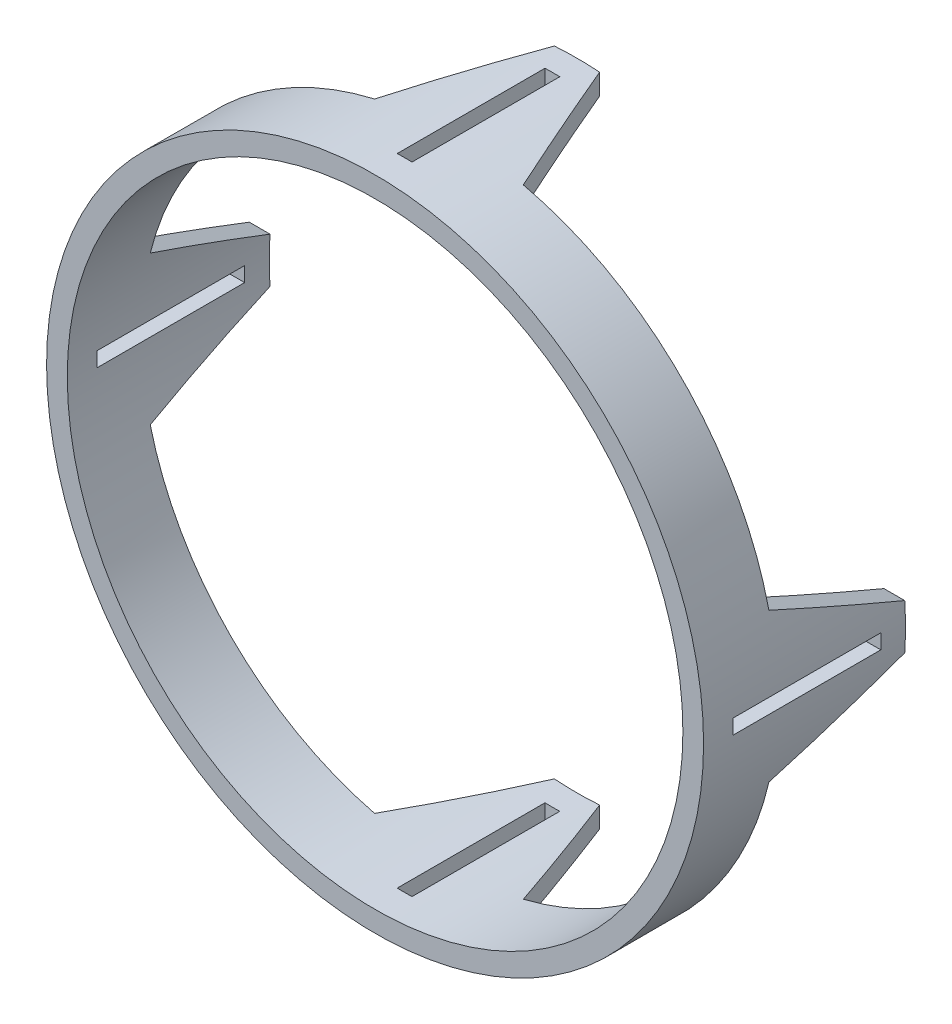
from build123d import *
from build123d.topology import SkipClean

# Parameters (mm, degrees)
SKETCH1_R           = 84.709
SKETCH1_R_2         = 79.375
BOSS_EXTRUDE1_DEPTH = 19.05
BOSS_EXTRUDE2_START = 33.02
BOSS_EXTRUDE2_DEPTH = 33.02
SKETCH2_W           = 3.81
SKETCH2_H           = 38.1
CUT_EXTRUDE1_DEPTH  = 125.264032455
CIRPATTERN1_COUNT   = 4
CHAMFER1_SIZE       = 13.462
CHAMFER1_SIZE_2     = 33.319619221


with BuildPart() as part:
    # Sketch1 → Boss-Extrude1 (new body)
    with BuildSketch(Plane.XY):
        with Locations(Location((0, 0, 0), (0, 0, 180))):
            Circle(SKETCH1_R)
        with Locations(Location((0, 0, 0), (0, 0, 180))):
            Circle(SKETCH1_R_2, mode=Mode.SUBTRACT)
    extrude(amount=BOSS_EXTRUDE1_DEPTH)

    # Sketch3 → Boss-Extrude2 (add)
    with SkipClean():  # the faces are left unmerged after this step: merging them gives an invalid solid
        with BuildSketch(Plane(origin=(0, 0, 0), x_dir=(-1, 0, 0), z_dir=(0, 0, -1)).offset(BOSS_EXTRUDE2_START)):
            with BuildLine():
                Line((-5.715, 79.168992668), (-5.715, 84.515995267))
                ThreePointArc((-5.715, 84.515995267), (0, 84.709), (5.715, 84.515995267))
                Line((5.715, 84.515995267), (5.715, 79.168992668))
                ThreePointArc((5.715, 79.168992668), (0, 79.375), (-5.715, 79.168992668))
            make_face()
            with BuildLine():
                Line((-5.715, -79.168992668), (-5.715, -84.515995267))
                ThreePointArc((-5.715, -84.515995267), (0, -84.709), (5.715, -84.515995267))
                Line((5.715, -84.515995267), (5.715, -79.168992668))
                ThreePointArc((5.715, -79.168992668), (0, -79.375), (-5.715, -79.168992668))
            make_face()
            with BuildLine():
                Line((79.168992668, -5.715), (84.515995267, -5.715))
                ThreePointArc((84.515995267, -5.715), (84.709, 0), (84.515995267, 5.715))
                Line((84.515995267, 5.715), (79.168992668, 5.715))
                ThreePointArc((79.168992668, 5.715), (79.375, 0), (79.168992668, -5.715))
            make_face()
            with BuildLine():
                Line((-79.168992668, 5.715), (-84.515995267, 5.715))
                ThreePointArc((-84.515995267, 5.715), (-84.709, 0), (-84.515995267, -5.715))
                Line((-84.515995267, -5.715), (-79.168992668, -5.715))
                ThreePointArc((-79.168992668, -5.715), (-79.375, 0), (-79.168992668, 5.715))
            make_face()
        extrude(amount=-BOSS_EXTRUDE2_DEPTH)

    # Sketch2 → Cut-Extrude1 (cut, through all)
    with SkipClean():  # the faces are left unmerged after this step: merging them gives an invalid solid
        with BuildSketch(Plane(origin=(0, 0, 0), x_dir=(1, 0, 0), z_dir=(0, 1, 0))):
            with Locations((0, 7.62)):
                Rectangle(SKETCH2_W, SKETCH2_H)
        cut_extrude1 = extrude(amount=-CUT_EXTRUDE1_DEPTH, mode=Mode.SUBTRACT)

    # CirPattern1: Cut-Extrude1 ×4 about axis
    with SkipClean():  # the faces are left unmerged after this step: merging them gives an invalid solid
        cirpattern1_axis = Axis((0, 0, 0), (0, 0, 1))
        for i in range(1, CIRPATTERN1_COUNT):
            add(cut_extrude1.rotate(cirpattern1_axis, i * 360 / CIRPATTERN1_COUNT), mode=Mode.SUBTRACT)

    # Chamfer1
    # the kernel refuses this chamfer: 33.319619221, 13.462 mm, written as the material it adds along each edge
    with BuildSketch(Plane(origin=(-5.715, 170.913401218, 0), x_dir=(-0.9961057015681392, 0, 0.08816706473193561), z_dir=(0, -1, 0))) as chamfer1_piece_1_section:
        Polygon((CHAMFER1_SIZE * 0.996105701568, CHAMFER1_SIZE * 0.0881670647319), (-CHAMFER1_SIZE_2 * 0.0881670647311, CHAMFER1_SIZE_2 * 0.996105701559), (0, 0), align=None)
    chamfer1_piece_1 = extrude(amount=178.141814502, mode=Mode.PRIVATE)
    chamfer1_piece_1 = chamfer1_piece_1 & Plane(origin=(0, 0, -11.191625659), x_dir=(-1, 0, 0), z_dir=(0, 0, -1)) * Cylinder(84.709, 490, mode=Mode.PRIVATE)
    chamfer1_piece_1 = chamfer1_piece_1 - Plane(origin=(0, 0, -11.191625659), x_dir=(-1, 0, 0), z_dir=(0, 0, -1)) * Cylinder(79.375, 490, mode=Mode.PRIVATE)
    chamfer1_piece_1 = split(chamfer1_piece_1, bisect_by=Plane(origin=(-9.949714127, 81.358468366, -33.02), z_dir=(0, 0, 1)), keep=Keep.TOP, mode=Mode.PRIVATE)
    add(chamfer1_piece_1)
    with BuildSketch(Plane(origin=(-170.913401218, 5.715, 0), x_dir=(1.3071407043529467e-14, 0.9961057015681392, 0.08816706473193561), z_dir=(1, 0, 0))) as chamfer1_piece_2_section:
        Polygon((CHAMFER1_SIZE * 0.996105701568, -CHAMFER1_SIZE * 0.0881670647319), (-CHAMFER1_SIZE_2 * 0.0881670647311, -CHAMFER1_SIZE_2 * 0.996105701559), (0, 0), align=None)
    chamfer1_piece_2 = extrude(amount=178.141814502, mode=Mode.PRIVATE)
    chamfer1_piece_2 = chamfer1_piece_2 & Plane(origin=(0, 0, -11.191625637), x_dir=(-1, 0, 0), z_dir=(0, 0, -1)) * Cylinder(84.709, 490, mode=Mode.PRIVATE)
    chamfer1_piece_2 = chamfer1_piece_2 - Plane(origin=(0, 0, -11.191625637), x_dir=(-1, 0, 0), z_dir=(0, 0, -1)) * Cylinder(79.375, 490, mode=Mode.PRIVATE)
    chamfer1_piece_2 = split(chamfer1_piece_2, bisect_by=Plane(origin=(-81.358468349, 9.949714129, -33.02), z_dir=(0, 0, 1)), keep=Keep.TOP, mode=Mode.PRIVATE)
    add(chamfer1_piece_2)
    with BuildSketch(Plane(origin=(5.715, -7.228413283, 0), x_dir=(0.9961057015681392, 0, 0.08816706473193561), z_dir=(0, 1, 0))) as chamfer1_piece_3_section:
        Polygon((CHAMFER1_SIZE * 0.996105701568, CHAMFER1_SIZE * 0.0881670647319), (-CHAMFER1_SIZE_2 * 0.0881670647311, CHAMFER1_SIZE_2 * 0.996105701559), (0, 0), align=None)
    chamfer1_piece_3 = extrude(amount=178.141814502, mode=Mode.PRIVATE)
    chamfer1_piece_3 = chamfer1_piece_3 & Plane(origin=(0, 0, -11.191625637), x_dir=(-1, 0, 0), z_dir=(0, 0, -1)) * Cylinder(84.709, 490, mode=Mode.PRIVATE)
    chamfer1_piece_3 = chamfer1_piece_3 - Plane(origin=(0, 0, -11.191625637), x_dir=(-1, 0, 0), z_dir=(0, 0, -1)) * Cylinder(79.375, 490, mode=Mode.PRIVATE)
    chamfer1_piece_3 = split(chamfer1_piece_3, bisect_by=Plane(origin=(9.949714129, 81.358468349, -33.02), z_dir=(0, 0, 1)), keep=Keep.TOP, mode=Mode.PRIVATE)
    add(chamfer1_piece_3)
    with BuildSketch(Plane(origin=(-7.228413283, 5.715, 0), x_dir=(-1.3071407043529467e-14, 0.9961057015681392, 0.08816706473193563), z_dir=(1, 0, 0))) as chamfer1_piece_4_section:
        Polygon((CHAMFER1_SIZE * 0.996105701568, -CHAMFER1_SIZE * 0.0881670647319), (-CHAMFER1_SIZE_2 * 0.0881670647311, -CHAMFER1_SIZE_2 * 0.996105701559), (0, 0), align=None)
    chamfer1_piece_4 = extrude(amount=178.141814502, mode=Mode.PRIVATE)
    chamfer1_piece_4 = chamfer1_piece_4 & Plane(origin=(0, 0, -11.191625658), x_dir=(-1, 0, 0), z_dir=(0, 0, -1)) * Cylinder(84.709, 490, mode=Mode.PRIVATE)
    chamfer1_piece_4 = chamfer1_piece_4 - Plane(origin=(0, 0, -11.191625658), x_dir=(-1, 0, 0), z_dir=(0, 0, -1)) * Cylinder(79.375, 490, mode=Mode.PRIVATE)
    chamfer1_piece_4 = split(chamfer1_piece_4, bisect_by=Plane(origin=(81.358468366, 9.949714127, -33.02), z_dir=(0, 0, 1)), keep=Keep.TOP, mode=Mode.PRIVATE)
    add(chamfer1_piece_4)
    with BuildSketch(Plane(origin=(-5.715, -170.913401218, 0), x_dir=(-0.9961057015681392, 0, 0.08816706473193561), z_dir=(0, 1, 0))) as chamfer1_piece_5_section:
        Polygon((CHAMFER1_SIZE * 0.996105701568, -CHAMFER1_SIZE * 0.0881670647319), (-CHAMFER1_SIZE_2 * 0.0881670647311, -CHAMFER1_SIZE_2 * 0.996105701559), (0, 0), align=None)
    chamfer1_piece_5 = extrude(amount=178.141814502, mode=Mode.PRIVATE)
    chamfer1_piece_5 = chamfer1_piece_5 & Plane(origin=(0, 0, -11.191625637), x_dir=(-1, 0, 0), z_dir=(0, 0, -1)) * Cylinder(84.709, 490, mode=Mode.PRIVATE)
    chamfer1_piece_5 = chamfer1_piece_5 - Plane(origin=(0, 0, -11.191625637), x_dir=(-1, 0, 0), z_dir=(0, 0, -1)) * Cylinder(79.375, 490, mode=Mode.PRIVATE)
    chamfer1_piece_5 = split(chamfer1_piece_5, bisect_by=Plane(origin=(-9.949714129, -81.358468349, -33.02), z_dir=(0, 0, 1)), keep=Keep.TOP, mode=Mode.PRIVATE)
    add(chamfer1_piece_5)
    with BuildSketch(Plane(origin=(7.228413283, -5.715, 0), x_dir=(-1.5553319773313542e-14, -0.9961057015681392, 0.08816706473193561), z_dir=(-1, 0, 0))) as chamfer1_piece_6_section:
        Polygon((CHAMFER1_SIZE * 0.996105701568, -CHAMFER1_SIZE * 0.0881670647319), (-CHAMFER1_SIZE_2 * 0.0881670647311, -CHAMFER1_SIZE_2 * 0.996105701559), (0, 0), align=None)
    chamfer1_piece_6 = extrude(amount=178.141814502, mode=Mode.PRIVATE)
    chamfer1_piece_6 = chamfer1_piece_6 & Plane(origin=(0, 0, -11.191625659), x_dir=(-1, 0, 0), z_dir=(0, 0, -1)) * Cylinder(84.709, 490, mode=Mode.PRIVATE)
    chamfer1_piece_6 = chamfer1_piece_6 - Plane(origin=(0, 0, -11.191625659), x_dir=(-1, 0, 0), z_dir=(0, 0, -1)) * Cylinder(79.375, 490, mode=Mode.PRIVATE)
    chamfer1_piece_6 = split(chamfer1_piece_6, bisect_by=Plane(origin=(-81.358468366, -9.949714127, -33.02), z_dir=(0, 0, 1)), keep=Keep.TOP, mode=Mode.PRIVATE)
    add(chamfer1_piece_6)
    with BuildSketch(Plane(origin=(5.715, 7.228413283, 0), x_dir=(0.9961057015681392, 0, 0.08816706473193563), z_dir=(0, -1, 0))) as chamfer1_piece_7_section:
        Polygon((CHAMFER1_SIZE * 0.996105701568, -CHAMFER1_SIZE * 0.0881670647319), (-CHAMFER1_SIZE_2 * 0.0881670647311, -CHAMFER1_SIZE_2 * 0.996105701559), (0, 0), align=None)
    chamfer1_piece_7 = extrude(amount=178.141814502, mode=Mode.PRIVATE)
    chamfer1_piece_7 = chamfer1_piece_7 & Plane(origin=(0, 0, -11.191625659), x_dir=(-1, 0, 0), z_dir=(0, 0, -1)) * Cylinder(84.709, 490, mode=Mode.PRIVATE)
    chamfer1_piece_7 = chamfer1_piece_7 - Plane(origin=(0, 0, -11.191625659), x_dir=(-1, 0, 0), z_dir=(0, 0, -1)) * Cylinder(79.375, 490, mode=Mode.PRIVATE)
    chamfer1_piece_7 = split(chamfer1_piece_7, bisect_by=Plane(origin=(9.949714127, -81.358468366, -33.02), z_dir=(0, 0, 1)), keep=Keep.TOP, mode=Mode.PRIVATE)
    add(chamfer1_piece_7)
    with BuildSketch(Plane(origin=(170.913401218, -5.715, 0), x_dir=(1.555331977331354e-14, -0.9961057015681392, 0.08816706473193561), z_dir=(-1, 0, 0))) as chamfer1_piece_8_section:
        Polygon((CHAMFER1_SIZE * 0.996105701568, -CHAMFER1_SIZE * 0.0881670647319), (-CHAMFER1_SIZE_2 * 0.0881670647311, -CHAMFER1_SIZE_2 * 0.996105701559), (0, 0), align=None)
    chamfer1_piece_8 = extrude(amount=178.141814502, mode=Mode.PRIVATE)
    chamfer1_piece_8 = chamfer1_piece_8 & Plane(origin=(0, 0, -11.191625637), x_dir=(-1, 0, 0), z_dir=(0, 0, -1)) * Cylinder(84.709, 490, mode=Mode.PRIVATE)
    chamfer1_piece_8 = chamfer1_piece_8 - Plane(origin=(0, 0, -11.191625637), x_dir=(-1, 0, 0), z_dir=(0, 0, -1)) * Cylinder(79.375, 490, mode=Mode.PRIVATE)
    chamfer1_piece_8 = split(chamfer1_piece_8, bisect_by=Plane(origin=(81.358468349, -9.949714129, -33.02), z_dir=(0, 0, 1)), keep=Keep.TOP, mode=Mode.PRIVATE)
    add(chamfer1_piece_8)


solid = part.part
